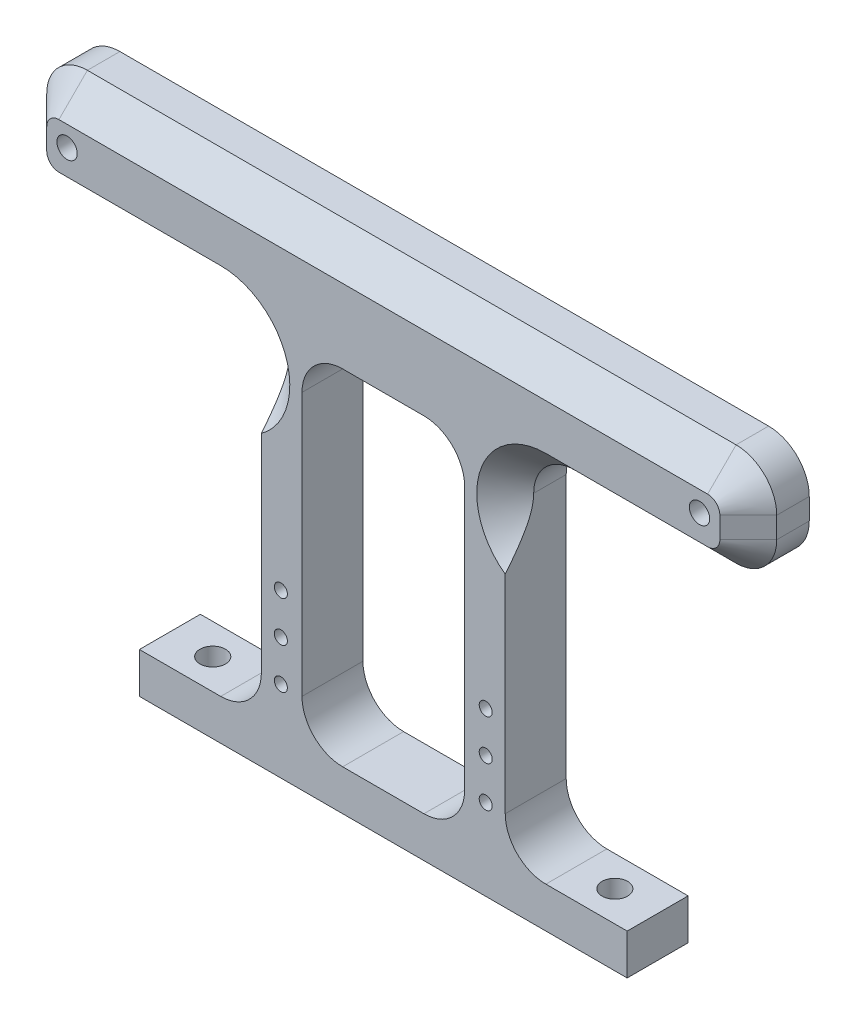
from build123d import *

# Parameters (mm, degrees)
SKETCH1_R                 = 1.5875
SKETCH1_W                 = 25.4
SKETCH1_H                 = 53.835078528
EXTRUDE1_DEPTH            = 9.525
FILLET1_R                 = 6.35
FILLET2_R                 = 6.35
CHAMFER3_SIZE             = 4.445
SKETCH2_R                 = 2.000000064
CUT_EXTRUDE1_DEPTH        = 91.671774296
SKETCH3_R                 = 1.016
CUT_EXTRUDE2_DEPTH        = 96.649297718
LPATTERN1_COUNT           = 3
LPATTERN1_PITCH           = 6.35
LPATTERN1_COPY_1_SKETCH_R = 1.016
LPATTERN1_COPY_1_DEPTH    = 96.649297718
LPATTERN1_COPY_2_SKETCH_R = 1.016
LPATTERN1_COPY_2_DEPTH    = 96.649297718


with BuildPart() as part:
    # Sketch1 → Extrude1 (new body)
    with BuildSketch(Plane.XY):
        Polygon((57.023, 60.185078528), (57.023, 76.2), (-57.023, 76.2), (-57.023, 60.185078528), (-19.05, 60.185078528), (-19.05, 6.35), (-38.1, 6.35), (-38.1, 0), (38.1, 0), (38.1, 6.35), (19.05, 6.35), (19.05, 60.185078528), align=None)
        with Locations((-49.403, 68.58)):
            Circle(SKETCH1_R, mode=Mode.SUBTRACT)
        with Locations((49.403, 68.58)):
            Circle(SKETCH1_R, mode=Mode.SUBTRACT)
        with Locations((0, 33.267539264)):
            Rectangle(SKETCH1_W, SKETCH1_H, mode=Mode.SUBTRACT)
    extrude(amount=-EXTRUDE1_DEPTH)

    # Fillet1
    fillet1_edges = [part.edges().sort_by_distance(p)[0] for p in [
        (-57.023, 60.185078528, -4.7625),
        (-57.023, 76.2, -4.7625),
        (57.023, 76.2, -4.7625),
        (57.023, 60.185078528, -4.7625),
    ]]
    fillet(fillet1_edges, radius=FILLET1_R)

    # Fillet2
    fillet2_edges = [part.edges().sort_by_distance(p)[0] for p in [
        (-19.05, 6.35, -4.7625),
        (-19.05, 60.185078528, -4.7625),
        (19.05, 60.185078528, -4.7625),
        (19.05, 6.35, -4.7625),
        (-12.7, 60.185078528, -4.7625),
        (12.7, 60.185078528, -4.7625),
        (12.7, 6.35, -4.7625),
        (-12.7, 6.35, -4.7625),
    ]]
    fillet(fillet2_edges, radius=FILLET2_R)

    # Chamfer3
    # the kernel refuses this chamfer: 4.445 mm, written as the material it takes off along each edge
    with BuildSketch(Plane(origin=(50.673, 76.2, 0), x_dir=(0, -0.9996219169112966, 0.02749587661058641), z_dir=(-1, 0, 0))) as chamfer3_piece_1:
        Polygon((CHAMFER3_SIZE * 0.999621916911, -CHAMFER3_SIZE * 0.0274958766106), (-CHAMFER3_SIZE * 0.0274958766106, -CHAMFER3_SIZE * 0.999621916911), (0, 0), align=None)
    extrude(amount=101.346, mode=Mode.SUBTRACT)
    with BuildSketch(Plane(origin=(57.023, 66.535078528, 0), x_dir=(-0.9996219169112966, 0, 0.027495876610586344), z_dir=(0, 1, 0)), Plane(origin=(-57.023, 69.85, 0), x_dir=(0.9996219169112966, 0, 0.027495876610586344), z_dir=(0, -1, 0))) as chamfer3_piece_2:
        Polygon((CHAMFER3_SIZE * 0.999621916911, -CHAMFER3_SIZE * 0.0274958766106), (-CHAMFER3_SIZE * 0.0274958766106, -CHAMFER3_SIZE * 0.999621916911), (0, 0), align=None)
    extrude(amount=3.314921472, mode=Mode.SUBTRACT)
    with BuildSketch(Plane(origin=(-50.673, 60.185078528, 0), x_dir=(0, 0.9996219169112966, 0.027495876610586344), z_dir=(1, 0, 0)), Plane(origin=(25.4, 60.185078528, 0), x_dir=(0, 0.9996219169112966, 0.02749587661058641), z_dir=(1, 0, 0))) as chamfer3_piece_3:
        Polygon((CHAMFER3_SIZE * 0.999621916911, -CHAMFER3_SIZE * 0.0274958766106), (-CHAMFER3_SIZE * 0.0274958766106, -CHAMFER3_SIZE * 0.999621916911), (0, 0), align=None)
    extrude(amount=25.273, mode=Mode.SUBTRACT)
    with BuildSketch(Plane(origin=(50.673, 66.535078528, 0), x_dir=(1, 0, 0), z_dir=(0, 1, 0))) as chamfer3_piece_4:
        Polygon((6.35 - CHAMFER3_SIZE, 0), (6.35, CHAMFER3_SIZE), (6.35, 0), align=None)
    revolve(axis=Axis((50.673, 66.535078528, 0), (0, 0, -1)), revolution_arc=90, mode=Mode.SUBTRACT)
    with BuildSketch(Plane(origin=(-50.673, 66.535078528, 0), x_dir=(-1, 0, 0), z_dir=(0, 1, 0))) as chamfer3_piece_5:
        Polygon((6.35 - CHAMFER3_SIZE, 0), (6.35, -CHAMFER3_SIZE), (6.35, 0), align=None)
    revolve(axis=Axis((-50.673, 66.535078528, 0), (0, 0, 1)), revolution_arc=90, mode=Mode.SUBTRACT)
    with BuildSketch(Plane(origin=(50.673, 69.85, 0), x_dir=(1, 0, 0), z_dir=(0, -1, 0))) as chamfer3_piece_6:
        Polygon((6.35 - CHAMFER3_SIZE, 0), (6.35, -CHAMFER3_SIZE), (6.35, 0), align=None)
    revolve(axis=Axis((50.673, 69.85, 0), (0, 0, 1)), revolution_arc=90, mode=Mode.SUBTRACT)
    with BuildSketch(Plane(origin=(-50.673, 69.85, 0), x_dir=(0, 1, 0), z_dir=(1, 0, 0))) as chamfer3_piece_7:
        Polygon((6.35 - CHAMFER3_SIZE, 0), (6.35, -CHAMFER3_SIZE), (6.35, 0), align=None)
    revolve(axis=Axis((-50.673, 69.85, 0), (0, 0, 1)), revolution_arc=90, mode=Mode.SUBTRACT)
    with BuildSketch(Plane(origin=(25.4, 53.835078528, 0), x_dir=(0, 1, 0), z_dir=(1, 0, 0))) as chamfer3_piece_8:
        Polygon((6.35 + CHAMFER3_SIZE, 0), (6.35, -CHAMFER3_SIZE), (6.35, 0), align=None)
    revolve(axis=Axis((25.4, 53.835078528, 0), (0, 0, 1)), revolution_arc=193.184040246, mode=Mode.SUBTRACT)
    with BuildSketch(Plane(origin=(-25.4, 53.835078528, 0), x_dir=(0, 1, 0), z_dir=(-1, 0, 0))) as chamfer3_piece_9:
        Polygon((6.35 + CHAMFER3_SIZE, 0), (6.35, CHAMFER3_SIZE), (6.35, 0), align=None)
    revolve(axis=Axis((-25.4, 53.835078528, 0), (0, 0, -1)), revolution_arc=193.184040246, mode=Mode.SUBTRACT)

    # Sketch2 → Cut-Extrude1 (cut, through all)
    with BuildSketch(Plane(origin=(0, 6.35, 0), x_dir=(1, 0, 0), z_dir=(0, 1, 0))):
        with Locations(Location((31.410975272, 4.7625, 0), (0, 0, 270))):
            Circle(SKETCH2_R)
    cut_extrude1 = extrude(amount=-CUT_EXTRUDE1_DEPTH, mode=Mode.SUBTRACT)

    # Mirror1: Cut-Extrude1 across plane
    add(cut_extrude1.mirror(Plane(origin=(0, 0, 0), x_dir=(0, 0, 1), z_dir=(1, 0, 0))), mode=Mode.SUBTRACT)

    # Sketch3 → Cut-Extrude2 (cut, through all)
    with BuildSketch(Plane.XY):
        with Locations((16.002, 25.4)):
            Circle(SKETCH3_R)
    cut_extrude2 = extrude(amount=-CUT_EXTRUDE2_DEPTH, mode=Mode.SUBTRACT)

    # Mirror2: Cut-Extrude2 across plane
    add(cut_extrude2.mirror(Plane(origin=(0, 0, 0), x_dir=(0, 0, 1), z_dir=(1, 0, 0))), mode=Mode.SUBTRACT)

    # LPattern1: Cut-Extrude2 ×3
    with Locations(*[(0, -i * LPATTERN1_PITCH, 0) for i in range(1, LPATTERN1_COUNT)]):
        add(cut_extrude2, mode=Mode.SUBTRACT)

    # LPattern1 copy 1 sketch → LPattern1 copy 1 (cut, through all)
    with BuildSketch(Plane(origin=(0, -6.35, 0), x_dir=(-1, 0, 0), z_dir=(0, 0, 1))):
        with Locations((16.002, -25.4)):
            Circle(LPATTERN1_COPY_1_SKETCH_R)
    extrude(amount=-LPATTERN1_COPY_1_DEPTH, mode=Mode.SUBTRACT)

    # LPattern1 copy 2 sketch → LPattern1 copy 2 (cut, through all)
    with BuildSketch(Plane(origin=(0, -12.7, 0), x_dir=(-1, 0, 0), z_dir=(0, 0, 1))):
        with Locations((16.002, -25.4)):
            Circle(LPATTERN1_COPY_2_SKETCH_R)
    extrude(amount=-LPATTERN1_COPY_2_DEPTH, mode=Mode.SUBTRACT)


solid = part.part
